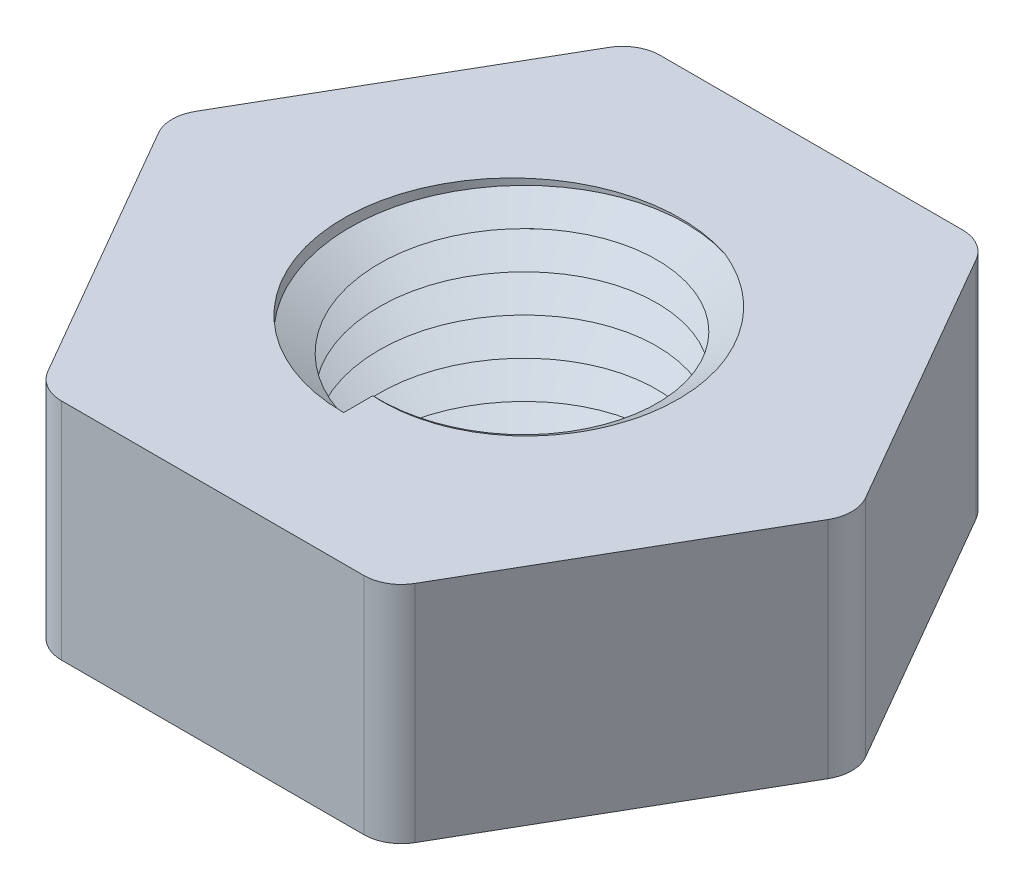
from build123d import *

# Parameters (mm, degrees)
BOSS_EXTRUDE1_DEPTH = 3
SKETCH2_R           = 2.25
CUT_EXTRUDE1_DEPTH  = 7.806859286
FILLET1_R           = 0.5
SWEEP3_PITCH        = 0.5


with BuildPart() as part:
    # Sketch1 → Boss-Extrude1 (new body)
    with BuildSketch(Plane(origin=(0, 0, 0), x_dir=(1, 0, 0), z_dir=(0, 1, 0))):
        Polygon((2.309401077, -4), (4.618802154, 0), (2.309401077, 4), (-2.309401077, 4), (-4.618802154, 0), (-2.309401077, -4), align=None)
    extrude(amount=BOSS_EXTRUDE1_DEPTH)

    # Sketch2 → Cut-Extrude1 (cut, through all)
    with BuildSketch(Plane(origin=(0, 3, 0), x_dir=(1, 0, 0), z_dir=(0, 1, 0))):
        with Locations(Location((0, 0, 0), (0, 0, 270))):
            Circle(SKETCH2_R)
    extrude(amount=-CUT_EXTRUDE1_DEPTH, mode=Mode.SUBTRACT)

    # Fillet1
    fillet1_edges = [part.edges().sort_by_distance(p)[0] for p in [
        (-2.309401077, 1.5, 4),
        (-4.618802154, 1.5, 0),
        (-2.309401077, 1.5, -4),
        (2.309401077, 1.5, -4),
        (4.618802154, 1.5, 0),
        (2.309401077, 1.5, 4),
    ]]
    fillet(fillet1_edges, radius=FILLET1_R)

    # Sweep3: the profile of Sketch5 profile screwed along a left-hand helix of 6 turns, 6 arcs to a turn; built about Z, then put on its axis
    sweep3_z = Axis((0, 0, 0), (0, 0, 1))
    sweep3_corners = [(2.2503, 0, 0.225173205), (1.860288568, 0, 0), (2.2503, 0, -0.225173205)]
    with BuildLine(mode=Mode.PRIVATE) as sweep3_profile:
        Line(sweep3_corners[0], sweep3_corners[1])
        Line(sweep3_corners[1], sweep3_corners[2])
        Line(sweep3_corners[2], sweep3_corners[0])
    sweep3_cap = Face(sweep3_profile.wire())
    sweep3_turn_angles = [0, -30, -60, -90, -120, -150, -180, -210, -240, -270, -300, -330, -360]
    sweep3_turn_weights = [1, 0.8660254037844387, 1, 0.8660254037844387, 1, 0.8660254037844387, 1, 0.8660254037844387, 1, 0.8660254037844387, 1, 0.8660254037844387, 1]
    sweep3_turn_rails = [Edge.make_bspline([Vector(p[0], p[1], 0).rotate(sweep3_z, sweep3_turn_angles[k]) / sweep3_turn_weights[k] + Vector(0, 0, p[2] + -SWEEP3_PITCH * sweep3_turn_angles[k] / 360) for k in range(13)], [0, 0, 0, 1, 1, 2, 2, 3, 3, 4, 4, 5, 5, 6, 6, 6], 2, sweep3_turn_weights) for p in sweep3_corners]
    sweep3_turn_sides = [Face.make_surface_from_curves(sweep3_turn_rails[p[0]], sweep3_turn_rails[p[1]]) for p in [(0, 1), (1, 2), (2, 0)]]
    sweep3 = Plane(origin=(0, 3, 0), x_dir=(0, 0, 1), z_dir=(0, -1, 0)) * Solid(Shell([*[p.moved(Location((0, 0, SWEEP3_PITCH * i))) for i in range(6) for p in sweep3_turn_sides], sweep3_cap, sweep3_cap.rotate(sweep3_z, -2160).moved(Location((0, 0, -SWEEP3_PITCH * -2160 / 360)))]))
    add(sweep3)

    # SurfaceCut1
    split(bisect_by=Plane(origin=(0, 3, 0), x_dir=(1, 0, 0), z_dir=(0, 1, 0)), keep=Keep.BOTTOM)

    # SurfaceCut2
    split(bisect_by=Plane(origin=(0, 0, 0), x_dir=(-1, 0, 0), z_dir=(0, -1, 0)), keep=Keep.BOTTOM)


solid = part.part
